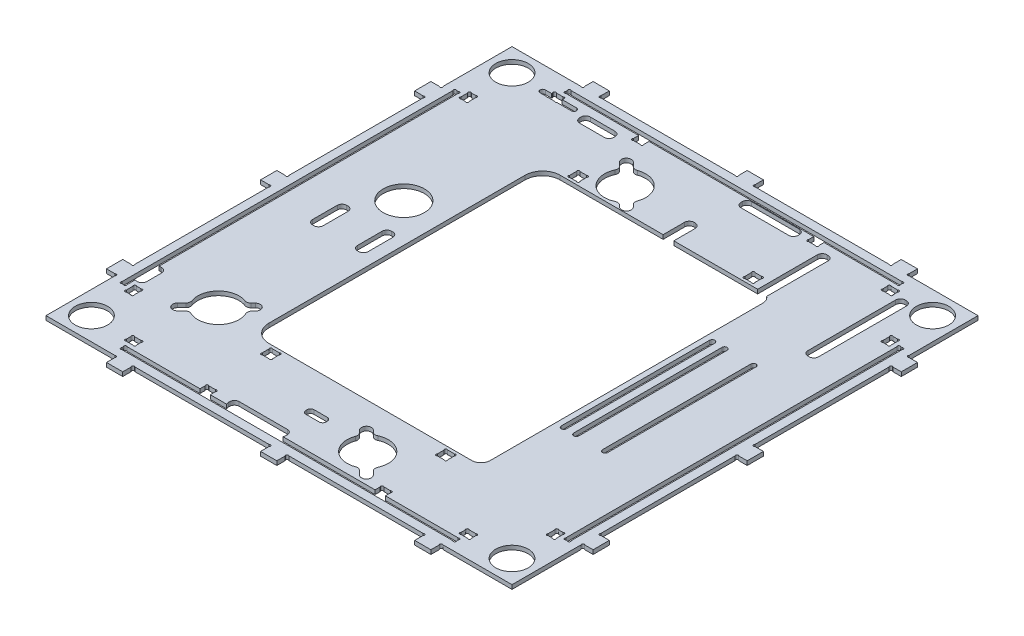
from build123d import *

# Parameters (mm, degrees)
SKETCH3_R           = 10
SKETCH3_R_2         = 12.700000135
BOSS_EXTRUDE1_DEPTH = 2.54


with BuildPart() as part:
    # Sketch3 → Boss-Extrude1 (new body)
    with BuildSketch(Plane(origin=(0, 0, 0), x_dir=(1, 0, 0), z_dir=(0, 1, 0))):
        with BuildLine():
            Line((306.35, 387.986388276), (306.35, 430.513856261))
            Line((306.35, 430.513856261), (263.822532015, 430.513856261))
            ThreePointArc((263.822532015, 430.513856261), (262.7, 430.513856261), (262.7, 431.636388276))
            Line((262.7, 431.636388276), (262.7, 436.863856261))
            Line((262.7, 436.863856261), (252.7, 436.814773326))
            Line((252.7, 436.814773326), (252.7, 431.636388276))
            ThreePointArc((252.7, 431.636388276), (252.7, 430.513856261), (251.577467985, 430.513856261))
            Line((251.577467985, 430.513856261), (168.796867225, 430.513856261))
            ThreePointArc((168.796867225, 430.513856261), (167.687585727, 430.551092867), (167.7, 431.660929744))
            Line((167.7, 431.660929744), (167.7, 436.863856261))
            Line((167.7, 436.863856261), (157.7, 436.863856261))
            Line((157.7, 436.863856261), (157.7, 431.660929744))
            ThreePointArc((157.7, 431.660929744), (157.712414273, 430.551092867), (156.603132775, 430.513856261))
            Line((156.603132775, 430.513856261), (73.796867225, 430.513856261))
            ThreePointArc((73.796867225, 430.513856261), (72.687585727, 430.551092867), (72.7, 431.660929744))
            Line((72.7, 431.660929744), (72.7, 436.863856261))
            Line((72.7, 436.863856261), (62.7, 436.863856261))
            Line((62.7, 436.863856261), (62.7, 431.660929744))
            ThreePointArc((62.7, 431.660929744), (62.712414273, 430.551092867), (61.603132775, 430.513856261))
            Line((61.603132775, 430.513856261), (19.05, 430.513856261))
            Line((19.05, 430.513856261), (19.05, 387.986388276))
            ThreePointArc((19.05, 387.986388276), (19.05, 386.863856261), (17.927467985, 386.863856261))
            Line((17.927467985, 386.863856261), (12.7, 386.863856261))
            Line((12.7, 386.863856261), (12.7, 376.814773315))
            Line((12.7, 376.814773315), (17.882345029, 376.814773315))
            ThreePointArc((17.882345029, 376.814773315), (19.025932504, 376.886933312), (19.05, 375.741324246))
            Line((19.05, 375.741324246), (19.05, 292.986388276))
            ThreePointArc((19.05, 292.986388276), (19.049999979, 291.863856282), (17.927467985, 291.863856261))
            Line((17.927467985, 291.863856261), (12.7, 291.863856261))
            Line((12.7, 291.863856261), (12.7, 281.863856261))
            Line((12.7, 281.863856261), (17.927467985, 281.863856261))
            ThreePointArc((17.927467985, 281.863856261), (19.05, 281.863856261), (19.05, 280.741324246))
            Line((19.05, 280.741324246), (19.05, 197.986388276))
            ThreePointArc((19.05, 197.986388276), (19.05, 196.863856261), (17.927467985, 196.863856261))
            Line((17.927467985, 196.863856261), (12.7, 196.863856261))
            Line((12.7, 196.863856261), (12.7, 186.863856261))
            Line((12.7, 186.863856261), (17.927467985, 186.863856261))
            ThreePointArc((17.927467985, 186.863856261), (19.05, 186.863856261), (19.05, 185.741324246))
            Line((19.05, 185.741324246), (19.05, 143.213856261))
            Line((19.05, 143.213856261), (61.603132775, 143.213856261))
            ThreePointArc((61.603132775, 143.213856261), (62.712414273, 143.176619655), (62.7, 142.066782778))
            Line((62.7, 142.066782778), (62.7, 136.863856261))
            Line((62.7, 136.863856261), (72.7, 136.863856261))
            Line((72.7, 136.863856261), (72.7, 142.066782778))
            ThreePointArc((72.7, 142.066782778), (72.687585727, 143.176619655), (73.796867225, 143.213856261))
            Line((73.796867225, 143.213856261), (156.603132775, 143.213856261))
            ThreePointArc((156.603132775, 143.213856261), (157.712414273, 143.176619655), (157.7, 142.066782778))
            Line((157.7, 142.066782778), (157.7, 136.863856261))
            Line((157.7, 136.863856261), (167.7, 136.863856261))
            Line((167.7, 136.863856261), (167.7, 142.066782778))
            ThreePointArc((167.7, 142.066782778), (167.687585727, 143.176619655), (168.796867225, 143.213856261))
            Line((168.796867225, 143.213856261), (251.577467985, 143.213856261))
            ThreePointArc((251.577467985, 143.213856261), (252.7, 143.213856261), (252.7, 142.091324246))
            Line((252.7, 142.091324246), (252.7, 136.863856261))
            Line((252.7, 136.863856261), (262.7, 136.863856261))
            Line((262.7, 136.863856261), (262.7, 142.091324246))
            ThreePointArc((262.7, 142.091324246), (262.7, 143.213856261), (263.822532015, 143.213856261))
            Line((263.822532015, 143.213856261), (306.35, 143.213856261))
            Line((306.35, 143.213856261), (306.35, 185.741324246))
            ThreePointArc((306.35, 185.741324246), (306.35, 186.863856261), (307.472532015, 186.863856261))
            Line((307.472532015, 186.863856261), (312.7, 186.863856261))
            Line((312.7, 186.863856261), (312.7, 196.863856261))
            Line((312.7, 196.863856261), (307.472532015, 196.863856261))
            ThreePointArc((307.472532015, 196.863856261), (306.35, 196.863856261), (306.35, 197.986388276))
            Line((306.35, 197.986388276), (306.35, 280.741324246))
            ThreePointArc((306.35, 280.741324246), (306.35, 281.863856261), (307.472532015, 281.863856261))
            Line((307.472532015, 281.863856261), (312.7, 281.863856261))
            Line((312.7, 281.863856261), (312.7, 291.863856261))
            Line((312.7, 291.863856261), (307.472532015, 291.863856261))
            ThreePointArc((307.472532015, 291.863856261), (306.35, 291.863856261), (306.35, 292.986388276))
            Line((306.35, 292.986388276), (306.35, 375.741324246))
            ThreePointArc((306.35, 375.741324246), (306.35, 376.863856261), (307.472532015, 376.863856261))
            Line((307.472532015, 376.863856261), (312.7, 376.863856261))
            Line((312.7, 376.863856261), (312.7, 386.863856261))
            Line((312.7, 386.863856261), (307.472532015, 386.863856261))
            ThreePointArc((307.472532015, 386.863856261), (306.35, 386.863856261), (306.35, 387.986388276))
        make_face()
        with Locations((33.05, 157.213856261)):
            Circle(SKETCH3_R, mode=Mode.SUBTRACT)
        with BuildLine():
            Line((56.35, 155.423184841), (56.35, 158.17812081))
            ThreePointArc((56.35, 158.17812081), (56.35, 159.300652826), (57.472532015, 159.300652826))
            Line((57.472532015, 159.300652826), (61.577467985, 159.300652826))
            ThreePointArc((61.577467985, 159.300652826), (62.7, 159.300652826), (62.7, 158.17812081))
            Line((62.7, 158.17812081), (62.7, 155.423184841))
            ThreePointArc((62.7, 155.423184841), (62.7, 154.300652826), (61.577467985, 154.300652826))
            Line((61.577467985, 154.300652826), (57.472532015, 154.300652826))
            ThreePointArc((57.472532015, 154.300652826), (56.35, 154.300652826), (56.35, 155.423184841))
        make_face(mode=Mode.SUBTRACT)
        with BuildLine():
            ThreePointArc((31.25932858, 180.513856261), (30.136796564, 180.513856261), (30.136796564, 181.636388276))
            Line((30.136796564, 181.636388276), (30.136796564, 185.741324246))
            ThreePointArc((30.136796564, 185.741324246), (30.136796564, 186.863856261), (31.25932858, 186.863856261))
            Line((31.25932858, 186.863856261), (34.014264549, 186.863856261))
            ThreePointArc((34.014264549, 186.863856261), (35.136796564, 186.863856261), (35.136796564, 185.741324246))
            Line((35.136796564, 185.741324246), (35.136796564, 181.636388276))
            ThreePointArc((35.136796564, 181.636388276), (35.136796564, 180.513856261), (34.014264549, 180.513856261))
            Line((34.014264549, 180.513856261), (31.25932858, 180.513856261))
        make_face(mode=Mode.SUBTRACT)
        with BuildLine():
            Line((52.84246319, 190.565337573), (55.363471703, 193.063633525))
            ThreePointArc((55.363471703, 193.063633525), (56.179284645, 194.539038964), (56.070533169, 196.22146135))
            ThreePointArc((56.070533169, 196.22146135), (59.063760073, 209.589599289), (72.458438969, 212.461723332))
            ThreePointArc((72.458438969, 212.461723332), (74.139808268, 212.337750559), (75.622536312, 213.140177823))
            Line((75.622536312, 213.140177823), (76.939918175, 214.445690977))
            ThreePointArc((76.939918175, 214.445690977), (81.182515427, 214.426493048), (81.163317497, 210.183895796))
            Line((81.163317497, 210.183895796), (80.17890537, 209.208352549))
            ThreePointArc((80.17890537, 209.208352549), (79.339736665, 207.618172894), (79.560544616, 205.833762823))
            ThreePointArc((79.560544616, 205.833762823), (76.942817395, 191.547999498), (62.633948924, 189.059664176))
            ThreePointArc((62.633948924, 189.059664176), (60.851610217, 189.296611814), (59.25390129, 188.471868438))
            Line((59.25390129, 188.471868438), (57.065862512, 186.303542392))
            ThreePointArc((57.065862512, 186.303542392), (52.823265261, 186.322740321), (52.84246319, 190.565337573))
        make_face(mode=Mode.SUBTRACT)
        with BuildLine():
            Line((219.863001598, 151.635524765), (264.752467985, 151.635524765))
            ThreePointArc((264.752467985, 151.635524765), (265.875, 151.635524765), (265.875, 150.51299275))
            Line((265.875, 150.51299275), (265.875, 149.58305678))
            ThreePointArc((265.875, 149.58305678), (265.875, 148.460524765), (264.752467985, 148.460524765))
            Line((264.752467985, 148.460524765), (60.647532015, 148.460524765))
            ThreePointArc((60.647532015, 148.460524765), (59.525, 148.460524765), (59.525, 149.58305678))
            Line((59.525, 149.58305678), (59.525, 150.51299275))
            ThreePointArc((59.525, 150.51299275), (59.525, 151.635524765), (60.647532015, 151.635524765))
            Line((60.647532015, 151.635524765), (105.563000185, 151.635524765))
            Line((105.563000185, 151.635524765), (105.563000185, 154.810326813))
            ThreePointArc((105.563000185, 154.810326813), (105.563000185, 155.932858829), (106.685532201, 155.932858829))
            Line((106.685532201, 155.932858829), (110.79046817, 155.932858829))
            ThreePointArc((110.79046817, 155.932858829), (111.912999914, 155.932858557), (111.912999642, 154.810326813))
            Line((111.912999642, 154.810326813), (111.912999642, 151.635524765))
            Line((111.912999642, 151.635524765), (122.023022692, 151.635524765))
            ThreePointArc((122.023022692, 151.635524765), (121.695300333, 152.369601443), (121.583149268, 153.165649589))
            Line((121.583149268, 153.165649589), (121.583149268, 153.990649589))
            ThreePointArc((121.583149268, 153.990649589), (122.427047854, 156.028001002), (124.464399268, 156.871899589))
            Line((124.464399268, 156.871899589), (154.198955155, 156.871899589))
            ThreePointArc((154.198955155, 156.871899589), (156.236306568, 156.028001002), (157.080205155, 153.990649589))
            Line((157.080205155, 153.990649589), (157.080205155, 153.165649589))
            ThreePointArc((157.080205155, 153.165649589), (156.968054089, 152.369601443), (156.64033173, 151.635524765))
            Line((156.64033173, 151.635524765), (213.513002139, 151.635524765))
            Line((213.513002139, 151.635524765), (213.513002139, 154.810326813))
            ThreePointArc((213.513002139, 154.810326813), (213.513002139, 155.932858829), (214.635534154, 155.932858829))
            Line((214.635534154, 155.932858829), (218.740470124, 155.932858829))
            ThreePointArc((218.740470124, 155.932858829), (219.863001868, 155.932858558), (219.863001598, 154.810326813))
            Line((219.863001598, 154.810326813), (219.863001598, 151.635524765))
        make_face(mode=Mode.SUBTRACT)
        with BuildLine():
            ThreePointArc((149.758483481, 173.548649589), (150.369898075, 175.024734995), (151.845983481, 175.636149589))
            Line((151.845983481, 175.636149589), (160.040955155, 175.636149589))
            ThreePointArc((160.040955155, 175.636149589), (161.51704056, 175.024734995), (162.128455155, 173.548649589))
            Line((162.128455155, 173.548649589), (162.128455155, 172.723649589))
            ThreePointArc((162.128455155, 172.723649589), (161.51704056, 171.247564183), (160.040955155, 170.636149589))
            Line((160.040955155, 170.636149589), (151.845983481, 170.636149589))
            ThreePointArc((151.845983481, 170.636149589), (150.369898075, 171.247564183), (149.758483481, 172.723649589))
            Line((149.758483481, 172.723649589), (149.758483481, 173.548649589))
        make_face(mode=Mode.SUBTRACT)
        with BuildLine():
            ThreePointArc((111.912999642, 190.07539765), (111.913002361, 188.952866178), (110.790470889, 188.952863459))
            Line((110.790470889, 188.952863459), (106.68553492, 188.952863459))
            ThreePointArc((106.68553492, 188.952863459), (105.563001546, 188.952859381), (105.563000185, 190.075392755))
            Line((105.563000185, 190.075392755), (105.563000185, 194.180328725))
            ThreePointArc((105.563000185, 194.180328725), (105.562996651, 195.302861555), (106.685529482, 195.302863459))
            Line((106.685529482, 195.302863459), (110.790465451, 195.302863459))
            ThreePointArc((110.790465451, 195.302863459), (111.912997738, 195.302865906), (111.912999642, 194.180333619))
            Line((111.912999642, 194.180333619), (111.912999642, 190.07539765))
        make_face(mode=Mode.SUBTRACT)
        with BuildLine():
            Line((24.296668504, 184.811388276), (24.296668504, 388.916324246))
            ThreePointArc((24.296668504, 388.916324246), (24.296668504, 390.038856261), (25.419200519, 390.038856261))
            Line((25.419200519, 390.038856261), (26.349136489, 390.038856261))
            ThreePointArc((26.349136489, 390.038856261), (27.471668504, 390.038856261), (27.471668504, 388.916324246))
            Line((27.471668504, 388.916324246), (27.471668504, 204.452086998))
            ThreePointArc((27.471668504, 204.452086998), (27.842284737, 204.526014623), (28.219388709, 204.550799297))
            Line((28.219388709, 204.550799297), (29.044388709, 204.550799297))
            ThreePointArc((29.044388709, 204.550799297), (31.081740122, 203.706900711), (31.925638709, 201.669549297))
            Line((31.925638709, 201.669549297), (31.925638709, 192.440626164))
            ThreePointArc((31.925638709, 192.440626164), (31.081740122, 190.40327475), (29.044388709, 189.559376164))
            Line((29.044388709, 189.559376164), (28.219388709, 189.559376164))
            ThreePointArc((28.219388709, 189.559376164), (27.842284737, 189.584160838), (27.471668504, 189.658088463))
            Line((27.471668504, 189.658088463), (27.471668504, 184.811388276))
            ThreePointArc((27.471668504, 184.811388276), (27.471668504, 183.688856261), (26.349136489, 183.688856261))
            Line((26.349136489, 183.688856261), (25.419200519, 183.688856261))
            ThreePointArc((25.419200519, 183.688856261), (24.296668504, 183.688856261), (24.296668504, 184.811388276))
        make_face(mode=Mode.SUBTRACT)
        with BuildLine():
            ThreePointArc((52.784516134, 273.80987696), (50.747164721, 274.653775547), (49.903266134, 276.69112696))
            Line((49.903266134, 276.69112696), (49.903266134, 291.931126541))
            ThreePointArc((49.903266134, 291.931126541), (50.747164721, 293.968477954), (52.784516134, 294.812376541))
            Line((52.784516134, 294.812376541), (53.609516134, 294.812376541))
            ThreePointArc((53.609516134, 294.812376541), (55.646867547, 293.968477954), (56.490766134, 291.931126541))
            Line((56.490766134, 291.931126541), (56.490766134, 276.69112696))
            ThreePointArc((56.490766134, 276.69112696), (55.646867547, 274.653775547), (53.609516134, 273.80987696))
            Line((53.609516134, 273.80987696), (52.784516134, 273.80987696))
        make_face(mode=Mode.SUBTRACT)
        with BuildLine():
            ThreePointArc((80.474515715, 273.80987696), (78.437164302, 274.653775547), (77.593265715, 276.69112696))
            Line((77.593265715, 276.69112696), (77.593265715, 291.931126541))
            ThreePointArc((77.593265715, 291.931126541), (78.437164302, 293.968477954), (80.474515715, 294.812376541))
            Line((80.474515715, 294.812376541), (81.299515715, 294.812376541))
            ThreePointArc((81.299515715, 294.812376541), (83.336867129, 293.968477954), (84.180765715, 291.931126541))
            Line((84.180765715, 291.931126541), (84.180765715, 276.69112696))
            ThreePointArc((84.180765715, 276.69112696), (83.336867129, 274.653775547), (81.299515715, 273.80987696))
            Line((81.299515715, 273.80987696), (80.474515715, 273.80987696))
        make_face(mode=Mode.SUBTRACT)
        with BuildLine():
            Line((200.852679401, 154.719840184), (198.34288239, 157.229399019))
            ThreePointArc((198.34288239, 157.229399019), (196.863762112, 158.038457221), (195.181854574, 157.922014096))
            ThreePointArc((195.181854574, 157.922014096), (181.800170013, 160.854084616), (178.866829543, 174.235490855))
            ThreePointArc((178.866829543, 174.235490855), (178.98311305, 175.917409437), (178.173914479, 177.396452925))
            Line((178.173914479, 177.396452925), (176.862391315, 178.707851628))
            ThreePointArc((176.862391315, 178.707851628), (176.862189996, 182.95049231), (181.104830678, 182.95069363))
            Line((181.104830678, 182.95069363), (182.084864899, 181.970752412))
            ThreePointArc((182.084864899, 181.970752412), (183.678864985, 181.138863491), (185.462246769, 181.367828253))
            ThreePointArc((185.462246769, 181.367828253), (199.759830173, 178.815449282), (202.313566015, 164.518108172))
            ThreePointArc((202.313566015, 164.518108172), (202.084770502, 162.734704666), (202.916810695, 161.140783536))
            Line((202.916810695, 161.140783536), (205.095118764, 158.962682186))
            ThreePointArc((205.095118764, 158.962682186), (205.095320083, 154.720041504), (200.852679401, 154.719840184))
        make_face(mode=Mode.SUBTRACT)
        with BuildLine():
            ThreePointArc((219.863001598, 190.075396015), (219.863002409, 188.95286373), (218.740470124, 188.952863459))
            Line((218.740470124, 188.952863459), (214.635534154, 188.952863459))
            ThreePointArc((214.635534154, 188.952863459), (213.513002139, 188.952863459), (213.513002139, 190.075395474))
            Line((213.513002139, 190.075395474), (213.513002139, 194.180331444))
            ThreePointArc((213.513002139, 194.180331444), (213.513002139, 195.302863459), (214.635534154, 195.302863459))
            Line((214.635534154, 195.302863459), (218.740470124, 195.302863459))
            ThreePointArc((218.740470124, 195.302863459), (219.863001598, 195.302863459), (219.863001598, 194.180331985))
            Line((219.863001598, 194.180331985), (219.863001598, 190.075396015))
        make_face(mode=Mode.SUBTRACT)
        with BuildLine():
            ThreePointArc((267.927467985, 159.300652826), (269.05, 159.300652826), (269.05, 158.17812081))
            Line((269.05, 158.17812081), (269.05, 155.423184841))
            ThreePointArc((269.05, 155.423184841), (269.05, 154.300652826), (267.927467985, 154.300652826))
            Line((267.927467985, 154.300652826), (263.822532015, 154.300652826))
            ThreePointArc((263.822532015, 154.300652826), (262.7, 154.300652826), (262.7, 155.423184841))
            Line((262.7, 155.423184841), (262.7, 158.17812081))
            ThreePointArc((262.7, 158.17812081), (262.7, 159.300652826), (263.822532015, 159.300652826))
            Line((263.822532015, 159.300652826), (267.927467985, 159.300652826))
        make_face(mode=Mode.SUBTRACT)
        with Locations((292.35, 157.213856261)):
            Circle(SKETCH3_R, mode=Mode.SUBTRACT)
        with BuildLine():
            ThreePointArc((291.385735451, 180.513856261), (290.263203436, 180.513856261), (290.263203436, 181.636388276))
            Line((290.263203436, 181.636388276), (290.263203436, 185.741324246))
            ThreePointArc((290.263203436, 185.741324246), (290.263203436, 186.863856261), (291.385735451, 186.863856261))
            Line((291.385735451, 186.863856261), (294.14067142, 186.863856261))
            ThreePointArc((294.14067142, 186.863856261), (295.263203436, 186.863856261), (295.263203436, 185.741324246))
            Line((295.263203436, 185.741324246), (295.263203436, 181.636388276))
            ThreePointArc((295.263203436, 181.636388276), (295.263203436, 180.513856261), (294.14067142, 180.513856261))
            Line((294.14067142, 180.513856261), (291.385735451, 180.513856261))
        make_face(mode=Mode.SUBTRACT)
        with BuildLine():
            ThreePointArc((299.980799481, 390.038856261), (301.103331496, 390.038856261), (301.103331496, 388.916324246))
            Line((301.103331496, 388.916324246), (301.103331496, 184.811388276))
            ThreePointArc((301.103331496, 184.811388276), (301.103331496, 183.688856261), (299.980799481, 183.688856261))
            Line((299.980799481, 183.688856261), (299.050863511, 183.688856261))
            ThreePointArc((299.050863511, 183.688856261), (297.928331496, 183.688856261), (297.928331496, 184.811388276))
            Line((297.928331496, 184.811388276), (297.928331496, 388.916324246))
            ThreePointArc((297.928331496, 388.916324246), (297.928331496, 390.038856261), (299.050863511, 390.038856261))
            Line((299.050863511, 390.038856261), (299.980799481, 390.038856261))
        make_face(mode=Mode.SUBTRACT)
        with Locations((68.001888709, 314.868149589)):
            Circle(SKETCH3_R_2, mode=Mode.SUBTRACT)
        with BuildLine():
            Line((102.563000531, 376.678598547), (166.054139127, 376.678598547))
            Line((166.054139127, 376.678598547), (166.054139127, 389.911604015))
            ThreePointArc((166.054139127, 389.911604015), (166.898037714, 391.948955429), (168.935389127, 392.792854015))
            Line((168.935389127, 392.792854015), (169.760389127, 392.792854015))
            ThreePointArc((169.760389127, 392.792854015), (171.797740541, 391.948955429), (172.641639127, 389.911604015))
            Line((172.641639127, 389.911604015), (172.641639127, 376.678598547))
            Line((172.641639127, 376.678598547), (224.336939901, 376.678598547))
            Line((224.336939901, 376.678598547), (224.336939901, 413.545649656))
            ThreePointArc((224.336939901, 413.545649656), (225.180838488, 415.583001069), (227.218189901, 416.426899656))
            Line((227.218189901, 416.426899656), (228.043189901, 416.426899656))
            ThreePointArc((228.043189901, 416.426899656), (230.080541315, 415.583001069), (230.924439901, 413.545649656))
            Line((230.924439901, 413.545649656), (230.924439901, 375.603774724))
            ThreePointArc((230.924439901, 375.603774724), (232.712897524, 373.539297602), (233.356750508, 370.884848546))
            Line((233.356750508, 370.884848546), (233.356750508, 202.884850229))
            ThreePointArc((233.356750508, 202.884850229), (231.659800421, 198.788050315), (227.563000507, 197.091100228))
            Line((227.563000507, 197.091100228), (102.563000531, 197.091100228))
            ThreePointArc((102.563000531, 197.091100228), (94.930666695, 200.252516415), (91.769250508, 207.884850251))
            Line((91.769250508, 207.884850251), (91.769250508, 365.884848524))
            ThreePointArc((91.769250508, 365.884848524), (94.930666695, 373.51718236), (102.563000531, 376.678598547))
        make_face(mode=Mode.SUBTRACT)
        with BuildLine():
            Line((30.136796564, 387.986388276), (30.136796564, 392.091324246))
            ThreePointArc((30.136796564, 392.091324246), (30.136796564, 393.213856261), (31.25932858, 393.213856261))
            Line((31.25932858, 393.213856261), (34.014264549, 393.213856261))
            ThreePointArc((34.014264549, 393.213856261), (35.136796564, 393.213856261), (35.136796564, 392.091324246))
            Line((35.136796564, 392.091324246), (35.136796564, 387.986388276))
            ThreePointArc((35.136796564, 387.986388276), (35.136796564, 386.863856261), (34.014264549, 386.863856261))
            Line((34.014264549, 386.863856261), (31.25932858, 386.863856261))
            ThreePointArc((31.25932858, 386.863856261), (30.136796564, 386.863856261), (30.136796564, 387.986388276))
        make_face(mode=Mode.SUBTRACT)
        with Locations((33.05, 416.513856261)):
            Circle(SKETCH3_R, mode=Mode.SUBTRACT)
        with BuildLine():
            Line((52.416388826, 417.666049589), (56.35, 417.666049589))
            Line((56.35, 417.666049589), (56.35, 418.304527682))
            ThreePointArc((56.35, 418.304527682), (56.35, 419.427059697), (57.472532015, 419.427059697))
            Line((57.472532015, 419.427059697), (61.577467985, 419.427059697))
            ThreePointArc((61.577467985, 419.427059697), (62.7, 419.427059697), (62.7, 418.304527682))
            Line((62.7, 418.304527682), (62.7, 417.666049589))
            Line((62.7, 417.666049589), (71.647988591, 417.666049589))
            ThreePointArc((71.647988591, 417.666049589), (73.235488591, 416.078549589), (71.647988591, 414.491049589))
            Line((71.647988591, 414.491049589), (62.757406384, 414.491049589))
            ThreePointArc((62.757406384, 414.491049589), (62.181717126, 414.19574037), (61.577467985, 414.427059697))
            Line((61.577467985, 414.427059697), (57.472532015, 414.427059697))
            ThreePointArc((57.472532015, 414.427059697), (56.868282874, 414.19574037), (56.292593616, 414.491049589))
            Line((56.292593616, 414.491049589), (52.416388826, 414.491049589))
            ThreePointArc((52.416388826, 414.491049589), (50.828888826, 416.078549589), (52.416388826, 417.666049589))
        make_face(mode=Mode.SUBTRACT)
        with BuildLine():
            Line((106.685522279, 384.7748506), (110.790458248, 384.7748506))
            ThreePointArc((110.790458248, 384.7748506), (111.912990265, 384.774859979), (111.912999642, 383.652327963))
            Line((111.912999642, 383.652327963), (111.912999642, 379.547391993))
            ThreePointArc((111.912999642, 379.547391993), (111.913009562, 378.424859977), (110.790477546, 378.424850059))
            Line((110.790477546, 378.424850059), (106.685541576, 378.424850059))
            ThreePointArc((106.685541576, 378.424850059), (105.563009564, 378.42484068), (105.563000185, 379.547372693))
            Line((105.563000185, 379.547372693), (105.563000185, 383.652308663))
            ThreePointArc((105.563000185, 383.652308663), (105.56299026, 384.774840681), (106.685522279, 384.7748506))
        make_face(mode=Mode.SUBTRACT)
        with BuildLine():
            Line((118.128610629, 406.239777464), (120.638407514, 403.730218503))
            ThreePointArc((120.638407514, 403.730218503), (122.117527751, 402.921160227), (123.799435295, 403.037603268))
            ThreePointArc((123.799435295, 403.037603268), (137.181119709, 400.105532077), (140.114459508, 386.724125691))
            ThreePointArc((140.114459508, 386.724125691), (139.998175917, 385.042207116), (140.807374414, 383.563163586))
            Line((140.807374414, 383.563163586), (142.118897512, 382.251764818))
            ThreePointArc((142.118897512, 382.251764818), (142.119098619, 378.009124136), (137.876457937, 378.008923029))
            Line((137.876457937, 378.008923029), (136.896423765, 378.988864295))
            ThreePointArc((136.896423765, 378.988864295), (135.302423721, 379.820753296), (133.519041925, 379.591788624))
            ThreePointArc((133.519041925, 379.591788624), (119.221458649, 382.144168311), (116.667723524, 396.441509549))
            ThreePointArc((116.667723524, 396.441509549), (116.896519126, 398.224913044), (116.064479012, 399.818834215))
            Line((116.064479012, 399.818834215), (113.886171053, 401.996935675))
            ThreePointArc((113.886171053, 401.996935675), (113.885969946, 406.239576357), (118.128610629, 406.239777464))
        make_face(mode=Mode.SUBTRACT)
        with BuildLine():
            ThreePointArc((98.89173829, 413.348049589), (98.047839703, 411.310698176), (96.01048829, 410.466799589))
            Line((96.01048829, 410.466799589), (80.770488709, 410.466799589))
            ThreePointArc((80.770488709, 410.466799589), (78.733137295, 411.310698176), (77.889238709, 413.348049589))
            Line((77.889238709, 413.348049589), (77.889238709, 414.173049589))
            ThreePointArc((77.889238709, 414.173049589), (78.733137295, 416.210401002), (80.770488709, 417.054299589))
            Line((80.770488709, 417.054299589), (96.01048829, 417.054299589))
            ThreePointArc((96.01048829, 417.054299589), (98.047839703, 416.210401002), (98.89173829, 414.173049589))
            Line((98.89173829, 414.173049589), (98.89173829, 413.348049589))
        make_face(mode=Mode.SUBTRACT)
        with BuildLine():
            ThreePointArc((265.875, 423.214719772), (265.875, 422.092187757), (264.752467985, 422.092187757))
            Line((264.752467985, 422.092187757), (219.863001598, 422.092187757))
            Line((219.863001598, 422.092187757), (219.863001598, 418.917385709))
            ThreePointArc((219.863001598, 418.917385709), (219.863001868, 417.794853964), (218.740470124, 417.794853694))
            Line((218.740470124, 417.794853694), (214.635534154, 417.794853694))
            ThreePointArc((214.635534154, 417.794853694), (213.513002139, 417.794853694), (213.513002139, 418.917385709))
            Line((213.513002139, 418.917385709), (213.513002139, 422.092187757))
            Line((213.513002139, 422.092187757), (111.912999642, 422.092187757))
            Line((111.912999642, 422.092187757), (111.912999642, 418.917385709))
            ThreePointArc((111.912999642, 418.917385709), (111.912999914, 417.794853966), (110.79046817, 417.794853694))
            Line((110.79046817, 417.794853694), (106.685532201, 417.794853694))
            ThreePointArc((106.685532201, 417.794853694), (105.563000185, 417.794853694), (105.563000185, 418.917385709))
            Line((105.563000185, 418.917385709), (105.563000185, 422.092187757))
            Line((105.563000185, 422.092187757), (60.647532015, 422.092187757))
            ThreePointArc((60.647532015, 422.092187757), (59.525, 422.092187757), (59.525, 423.214719772))
            Line((59.525, 423.214719772), (59.525, 424.144655742))
            ThreePointArc((59.525, 424.144655742), (59.525, 425.267187757), (60.647532015, 425.267187757))
            Line((60.647532015, 425.267187757), (264.752467985, 425.267187757))
            ThreePointArc((264.752467985, 425.267187757), (265.875, 425.267187757), (265.875, 424.144655742))
            Line((265.875, 424.144655742), (265.875, 423.214719772))
        make_face(mode=Mode.SUBTRACT)
        with BuildLine():
            ThreePointArc((236.746788709, 334.654749472), (238.334288709, 336.242249472), (239.921788709, 334.654749472))
            Line((239.921788709, 334.654749472), (239.921788709, 243.214749589))
            ThreePointArc((239.921788709, 243.214749589), (238.334288709, 241.627249589), (236.746788709, 243.214749589))
            Line((236.746788709, 243.214749589), (236.746788709, 334.654749472))
        make_face(mode=Mode.SUBTRACT)
        with BuildLine():
            ThreePointArc((244.366788709, 334.654749472), (245.954288709, 336.242249472), (247.541788709, 334.654749472))
            Line((247.541788709, 334.654749472), (247.541788709, 243.214749589))
            ThreePointArc((247.541788709, 243.214749589), (245.954288709, 241.627249589), (244.366788709, 243.214749589))
            Line((244.366788709, 243.214749589), (244.366788709, 334.654749472))
        make_face(mode=Mode.SUBTRACT)
        with BuildLine():
            ThreePointArc((262.146788709, 334.654749472), (263.734288709, 336.242249472), (265.321788709, 334.654749472))
            Line((265.321788709, 334.654749472), (265.321788709, 243.214749589))
            ThreePointArc((265.321788709, 243.214749589), (263.734288709, 241.627249589), (262.146788709, 243.214749589))
            Line((262.146788709, 243.214749589), (262.146788709, 334.654749472))
        make_face(mode=Mode.SUBTRACT)
        with BuildLine():
            Line((214.635529435, 384.7748506), (218.740465405, 384.7748506))
            ThreePointArc((218.740465405, 384.7748506), (219.86299742, 384.774854778), (219.863001598, 383.652322762))
            Line((219.863001598, 383.652322762), (219.863001598, 379.547386793))
            ThreePointArc((219.863001598, 379.547386793), (219.863006317, 378.424854778), (218.740474301, 378.424850059))
            Line((218.740474301, 378.424850059), (214.635538332, 378.424850059))
            ThreePointArc((214.635538332, 378.424850059), (213.513006317, 378.424845881), (213.513002139, 379.547377896))
            Line((213.513002139, 379.547377896), (213.513002139, 383.652313866))
            ThreePointArc((213.513002139, 383.652313866), (213.51299742, 384.774845881), (214.635529435, 384.7748506))
        make_face(mode=Mode.SUBTRACT)
        with BuildLine():
            ThreePointArc((208.028938709, 417.902514653), (207.185040122, 415.865163239), (205.147688709, 415.021264653))
            Line((205.147688709, 415.021264653), (175.691688709, 415.021264653))
            ThreePointArc((175.691688709, 415.021264653), (173.654337295, 415.865163239), (172.810438709, 417.902514653))
            Line((172.810438709, 417.902514653), (172.810438709, 418.727514653))
            ThreePointArc((172.810438709, 418.727514653), (173.654337295, 420.764866066), (175.691688709, 421.608764653))
            Line((175.691688709, 421.608764653), (205.147688709, 421.608764653))
            ThreePointArc((205.147688709, 421.608764653), (207.185040122, 420.764866066), (208.028938709, 418.727514653))
            Line((208.028938709, 418.727514653), (208.028938709, 417.902514653))
        make_face(mode=Mode.SUBTRACT)
        with BuildLine():
            ThreePointArc((272.596940027, 413.545649656), (273.440838614, 415.583001069), (275.478190027, 416.426899656))
            Line((275.478190027, 416.426899656), (276.303190027, 416.426899656))
            ThreePointArc((276.303190027, 416.426899656), (278.340541441, 415.583001069), (279.184440027, 413.545649656))
            Line((279.184440027, 413.545649656), (279.184440027, 359.380649656))
            ThreePointArc((279.184440027, 359.380649656), (278.340541441, 357.343298242), (276.303190027, 356.499399656))
            Line((276.303190027, 356.499399656), (275.478190027, 356.499399656))
            ThreePointArc((275.478190027, 356.499399656), (273.440838614, 357.343298242), (272.596940027, 359.380649656))
            Line((272.596940027, 359.380649656), (272.596940027, 413.545649656))
        make_face(mode=Mode.SUBTRACT)
        with BuildLine():
            Line((290.263203436, 387.986388276), (290.263203436, 392.091324246))
            ThreePointArc((290.263203436, 392.091324246), (290.263203436, 393.213856261), (291.385735451, 393.213856261))
            Line((291.385735451, 393.213856261), (294.14067142, 393.213856261))
            ThreePointArc((294.14067142, 393.213856261), (295.263203436, 393.213856261), (295.263203436, 392.091324246))
            Line((295.263203436, 392.091324246), (295.263203436, 387.986388276))
            ThreePointArc((295.263203436, 387.986388276), (295.263203436, 386.863856261), (294.14067142, 386.863856261))
            Line((294.14067142, 386.863856261), (291.385735451, 386.863856261))
            ThreePointArc((291.385735451, 386.863856261), (290.263203436, 386.863856261), (290.263203436, 387.986388276))
        make_face(mode=Mode.SUBTRACT)
        with BuildLine():
            Line((269.05, 418.304527682), (269.05, 415.549591712))
            ThreePointArc((269.05, 415.549591712), (269.05, 414.427059697), (267.927467985, 414.427059697))
            Line((267.927467985, 414.427059697), (263.822532015, 414.427059697))
            ThreePointArc((263.822532015, 414.427059697), (262.7, 414.427059697), (262.7, 415.549591712))
            Line((262.7, 415.549591712), (262.7, 418.304527682))
            ThreePointArc((262.7, 418.304527682), (262.7, 419.427059697), (263.822532015, 419.427059697))
            Line((263.822532015, 419.427059697), (267.927467985, 419.427059697))
            ThreePointArc((267.927467985, 419.427059697), (269.05, 419.427059697), (269.05, 418.304527682))
        make_face(mode=Mode.SUBTRACT)
        with Locations((292.35, 416.513856261)):
            Circle(SKETCH3_R, mode=Mode.SUBTRACT)
    extrude(amount=BOSS_EXTRUDE1_DEPTH)


solid = part.part
